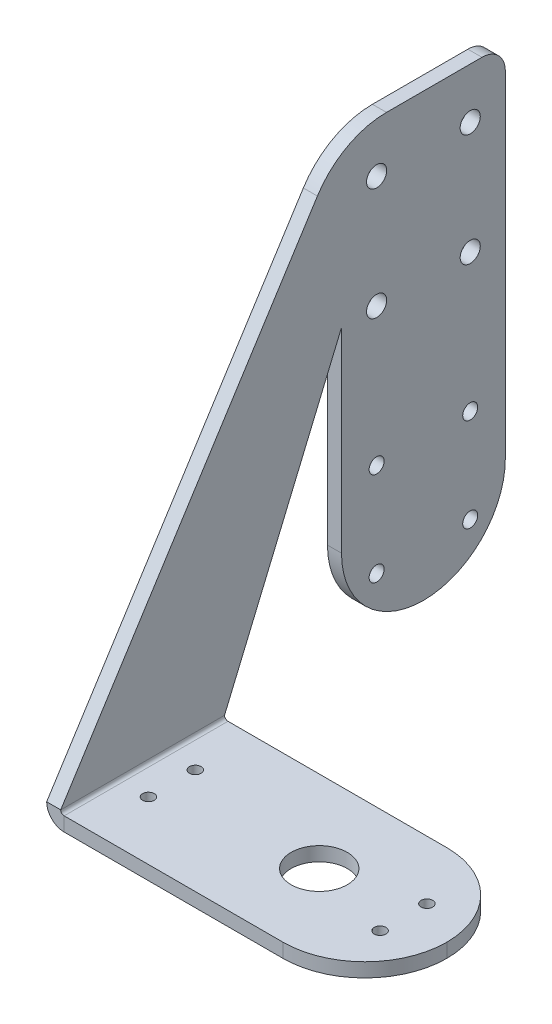
from build123d import *

# Parameters (mm, degrees)
SM_BASE_FLANGE_1_DEPTH = 95
FILLET_1_R             = 17.5
SKETCH_9_R             = 2.15
SKETCH_9_R_2           = 1.6
CUT_EXTRUDE_1_DEPTH    = 10
FILLET_2_R             = 5
CUT_EXTRUDE_START      = -10
CUT_EXTRUDE_2_DEPTH    = 10
SKETCH_14_W            = 71.334593732
SKETCH_14_H            = 13.225299836
CUT_EXTRUDE_3_DEPTH    = 60
FILLET_4_R             = 17.5
FILLET_5_R             = 17.5
SKETCH_15_R            = 6
CUT_EXTRUDE_4_DEPTH    = 10
SKETCH_16_R            = 1.25
CUT_EXTRUDE_5_DEPTH    = 10


# Sheet-metal steps are written as plain solids
with BuildPart() as part:
    # Sketch 2 → 基材-凸緣1 (new body)
    with BuildSketch(Plane.XY):
        with BuildLine():
            Line((65, 0), (0.7366, 0))
            ThreePointArc((0.7366, 0), (0.215745145, 0.215745145), (0, 0.7366))
            Line((0, 0.7366), (0, 95))
            Line((0, 95), (-3, 95))
            Line((-3, 95), (-3, 0.7366))
            ThreePointArc((-3, 0.7366), (-1.905575199, -1.905575199), (0.7366, -3))
            Line((0.7366, -3), (65, -3))
            Line((65, -3), (65, 0))
        make_face()
    extrude(amount=SM_BASE_FLANGE_1_DEPTH)

    # 圓角1
    fillet_1_edges = [part.edges().sort_by_distance(p)[0] for p in [
        (65, -1.5, 95),
        (65, -1.5, 0),
    ]]
    fillet(fillet_1_edges, radius=FILLET_1_R)

    # 草圖9 → 除料-伸長1 (cut)
    with BuildSketch(Plane(origin=(0, 0, 0), x_dir=(0, 0, -1), z_dir=(1, 0, 0))):
        with Locations((-7.5, 60.2366)):
            Circle(SKETCH_9_R)
        with Locations((-27.5, 60.2366)):
            Circle(SKETCH_9_R)
        with BuildLine():
            ThreePointArc((-5.35, 84.2366), (-7.5, 86.3866), (-9.65, 84.2366))
            ThreePointArc((-9.65, 84.2366), (-7.5, 82.0866), (-5.35, 84.2366))
        make_face()
        with Locations((-27.5, 84.2366)):
            Circle(SKETCH_9_R)
        with Locations((-7.5, 30.7366)):
            Circle(SKETCH_9_R_2)
        with Locations((-7.5, 10.7366)):
            Circle(SKETCH_9_R_2)
        with Locations((-27.5, 10.7366)):
            Circle(SKETCH_9_R_2)
        with Locations((-27.5, 30.7366)):
            Circle(SKETCH_9_R_2)
    extrude(amount=-CUT_EXTRUDE_1_DEPTH, mode=Mode.SUBTRACT)

    # 圓角2
    fillet_2_edges = [part.edges().sort_by_distance(p)[0] for p in [
        (-1.5, 95, 95),
        (-1.5, 95, 0),
    ]]
    fillet(fillet_2_edges, radius=FILLET_2_R)

    # 草圖12 → 除料-伸長2 (cut)
    with BuildSketch(Plane(origin=(0, 0, 0), x_dir=(0, 0, -1), z_dir=(1, 0, 0)).offset(CUT_EXTRUDE_START)):
        Polygon((-35, 0.7366), (-35, 60), (-60, 0.7366), align=None)
        with BuildLine():
            Line((-90, 95), (-35, 95))
            Line((-35, 95), (-95, 0.7366))
            Line((-95, 0.7366), (-95, 90))
            ThreePointArc((-95, 90), (-93.535533906, 93.535533906), (-90, 95))
        make_face()
    extrude(amount=CUT_EXTRUDE_2_DEPTH, mode=Mode.SUBTRACT)

    # 草圖14 → 除料-伸長3 (cut)
    with BuildSketch(Plane(origin=(0, 0, 0), x_dir=(-1, 0, 0), z_dir=(0, 0, -1))):
        with Locations((-32.667296866, -5.876049918)):
            Rectangle(SKETCH_14_W, SKETCH_14_H)
    extrude(amount=-CUT_EXTRUDE_3_DEPTH, mode=Mode.SUBTRACT)

    # 圓角4
    fillet_4_edges = [part.edges().sort_by_distance(p)[0] for p in [
        (-1.5, 0.7366, 35),
        (-1.5, 0.7366, 0),
        (65, -1.5, 60),
    ]]
    fillet(fillet_4_edges, radius=FILLET_4_R - 0.0001)  # a hair under: the kernel refuses the full size

    # 圓角5
    fillet_5_edges = [part.edges().sort_by_distance(p)[0] for p in [
        (-1.5, 95, 35),
    ]]
    fillet(fillet_5_edges, radius=FILLET_5_R)

    # 草圖15 → 除料-伸長4 (cut)
    with BuildSketch(Plane(origin=(0, 0, 0), x_dir=(1, 0, 0), z_dir=(0, 1, 0))):
        with Locations(Location((37.7366, -77.5, 0), (0, 0, 270))):
            Circle(SKETCH_15_R)
    extrude(amount=-CUT_EXTRUDE_4_DEPTH, mode=Mode.SUBTRACT)

    # 草圖16 → 除料-伸長5 (cut)
    with BuildSketch(Plane(origin=(0, 0, 0), x_dir=(1, 0, 0), z_dir=(0, 1, 0))):
        with Locations(Location((6.2466, -72.5, 0), (0, 0, 270))):
            Circle(SKETCH_16_R)
        with Locations(Location((55.7466, -72.5, 0), (0, 0, 270))):
            Circle(SKETCH_16_R)
        with Locations(Location((55.7466, -82.5, 0), (0, 0, 270))):
            Circle(SKETCH_16_R)
        with Locations(Location((6.2466, -82.5, 0), (0, 0, 270))):
            Circle(SKETCH_16_R)
    extrude(amount=-CUT_EXTRUDE_5_DEPTH, mode=Mode.SUBTRACT)


solid = part.part
